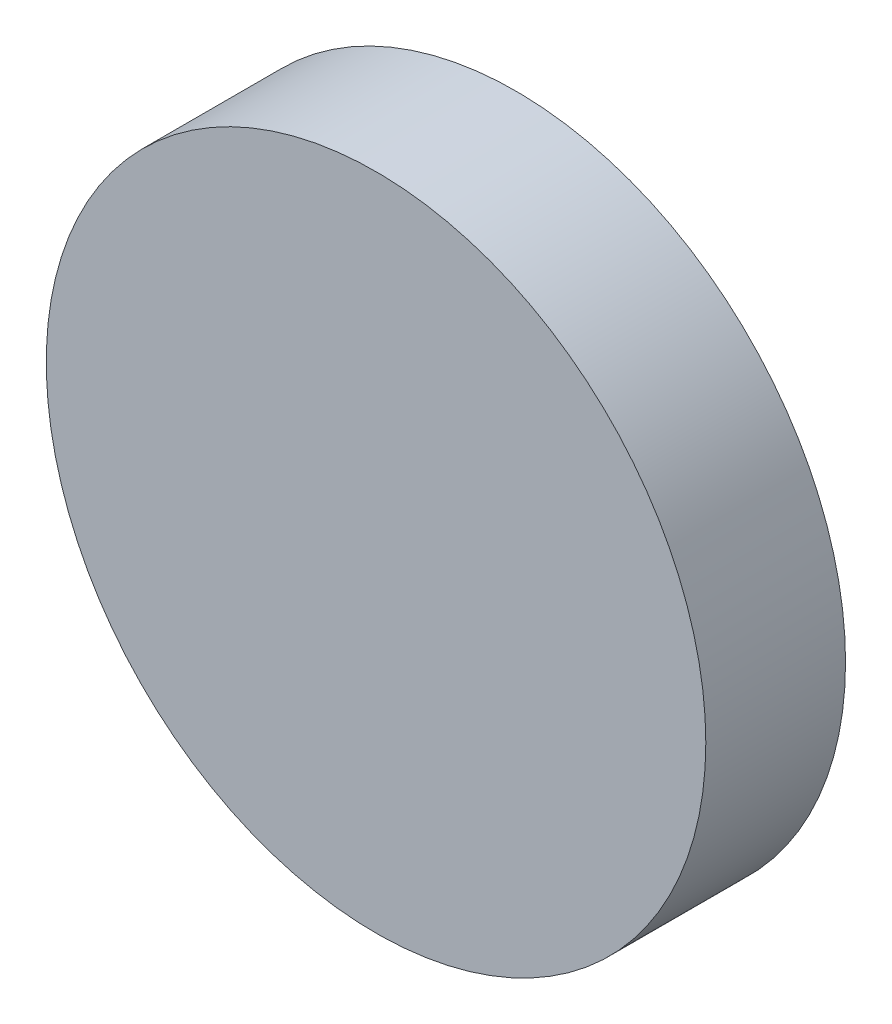
from build123d import *

# Parameters (mm, degrees)
SCHIZZO1_R                   = 23.6
ESTRUSIONE_ESTRUSIONE1_DEPTH = 10


with BuildPart() as part:
    # Schizzo1 → Estrusione-Estrusione1 (new body)
    with BuildSketch(Plane.XY):
        Circle(SCHIZZO1_R)
    extrude(amount=ESTRUSIONE_ESTRUSIONE1_DEPTH)


solid = part.part
